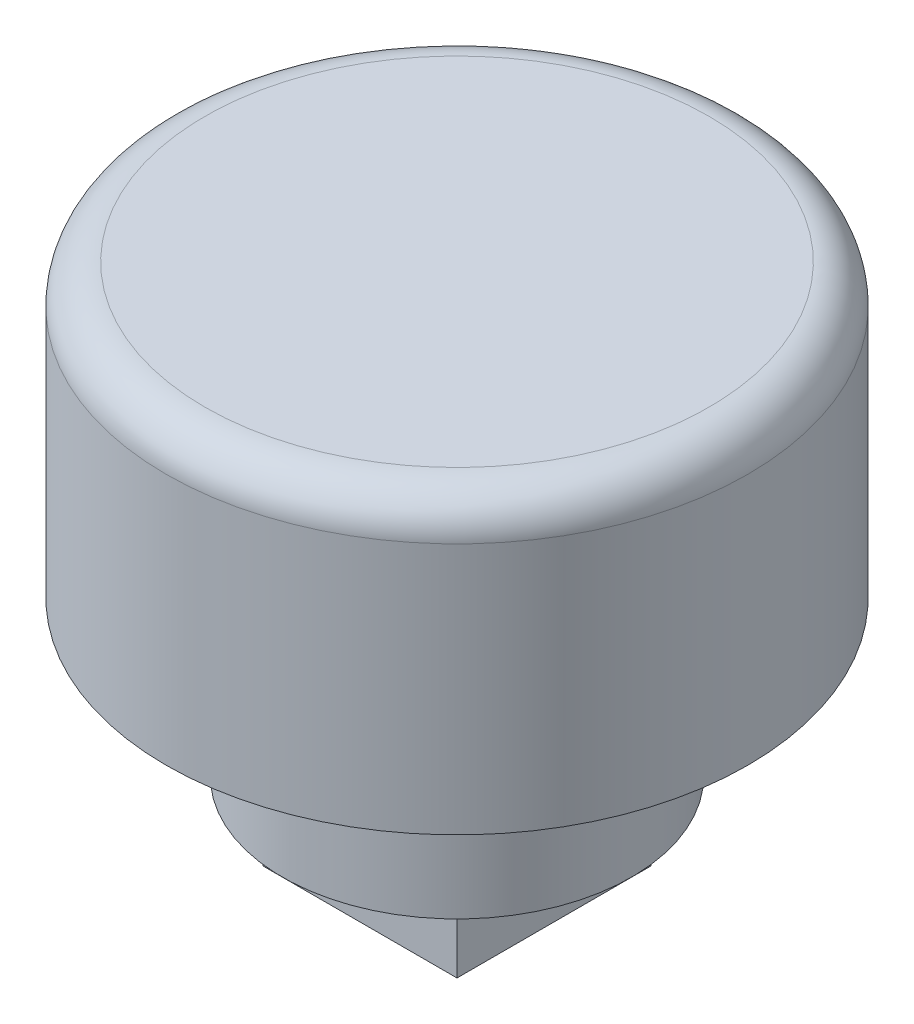
from build123d import *

# Parameters (mm, degrees)
SKETCH1_R           = 7.5
BOSS_EXTRUDE1_DEPTH = 7.5
FILLET1_R           = 1
SKETCH2_R           = 4.5
BOSS_EXTRUDE2_DEPTH = 4
SKETCH3_W           = 5
SKETCH3_H           = 5
BOSS_EXTRUDE3_DEPTH = 2


with BuildPart() as part:
    # Sketch1 → Boss-Extrude1 (new body)
    with BuildSketch(Plane(origin=(0, 0, 0), x_dir=(1, 0, 0), z_dir=(0, 1, 0))):
        Circle(SKETCH1_R)
    extrude(amount=BOSS_EXTRUDE1_DEPTH)

    # Fillet1
    fillet1_edges = [part.edges().sort_by_distance(p)[0] for p in [
        (-7.5, 7.5, 0),
    ]]
    fillet(fillet1_edges, radius=FILLET1_R)

    # Sketch2 → Boss-Extrude2 (add)
    with BuildSketch(Plane(origin=(0, 0, 0), x_dir=(-1, 0, 0), z_dir=(0, -1, 0))):
        Circle(SKETCH2_R)
    extrude(amount=BOSS_EXTRUDE2_DEPTH)

    # Sketch3 → Boss-Extrude3 (add)
    with BuildSketch(Plane(origin=(0, -4, 0), x_dir=(-1, 0, 0), z_dir=(0, -1, 0))):
        Rectangle(SKETCH3_W, SKETCH3_H)
    extrude(amount=BOSS_EXTRUDE3_DEPTH)


solid = part.part
